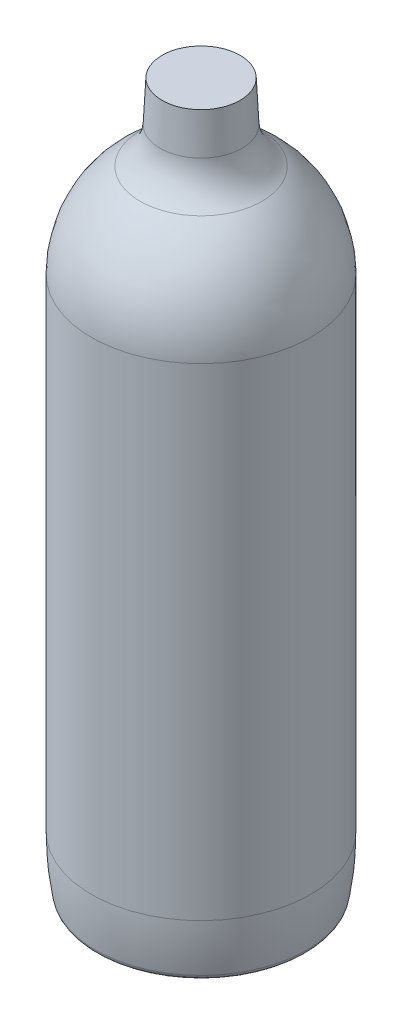
from build123d import *


with BuildPart() as part:
    # Skica1 → Rotovat1 (revolve)
    with BuildSketch(Plane.XY):
        with BuildLine():
            Line((-2, 9.937438845), (0, 9.937438845))
            Line((0, 9.937438845), (0, 231))
            Line((0, 231), (-12.618810271, 231))
            ThreePointArc((-12.618810271, 231), (-12.903232124, 224.440073791), (-13.253405947, 217.883328719))
            ThreePointArc((-13.253405947, 217.883328719), (-15.159184085, 211.33843471), (-19.721855633, 206.273885742))
            ThreePointArc((-19.721855633, 206.273885742), (-31.283356959, 193.057862433), (-35.45, 176))
            Line((-35.45, 176), (-35.45, 20))
            ThreePointArc((-35.45, 20), (-35.094324076, 11.796758267), (-34.029965847, 3.655086334))
            ThreePointArc((-34.029965847, 3.655086334), (-33.114653771, 2.300717404), (-31.494757975, 2.081516571))
            Line((-31.494757975, 2.081516571), (-9.042779517, 8.69573486))
            ThreePointArc((-9.042779517, 8.69573486), (-5.556185927, 9.513946086), (-2, 9.937438845))
        make_face()
    revolve(axis=Axis((0, 0, 0), (0, 1, 0)))


solid = part.part
